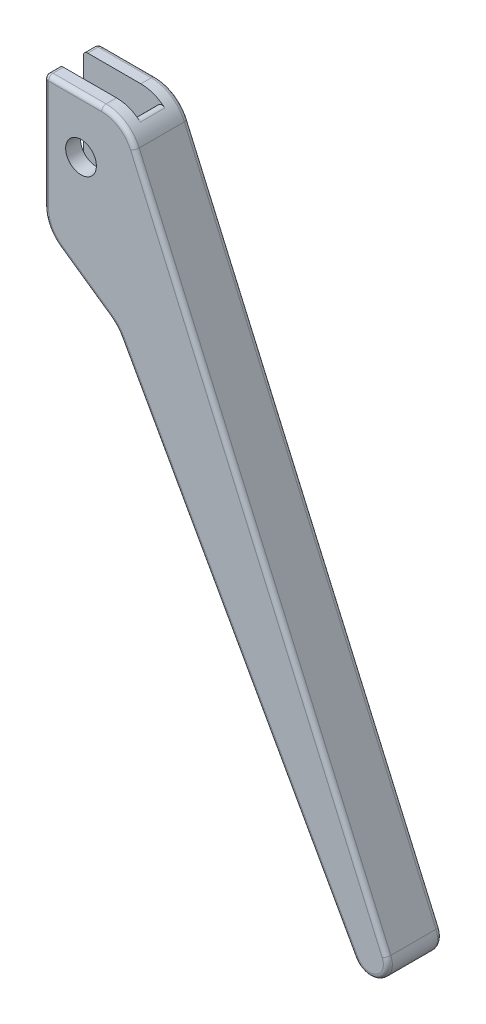
from build123d import *

# Parameters (mm, degrees)
BOSS_EXTRUDE1_DEPTH      = 3
BOSS_EXTRUDE1_DEPTH_BACK = 3
SKETCH1_R                = 1.7
CUT_EXTRUDE1_DEPTH       = 1.35
CUT_EXTRUDE1_DEPTH_BACK  = 1.35
CUT_EXTRUDE1_START       = -3
FILLET1_R                = 2
FILLET2_R                = 0.5
FILLET3_R                = 4
FILLET4_R                = 4
FILLET5_R                = 4
FILLET6_R                = 0.5
FILLET7_R                = 0.5


with BuildPart() as part:
    # Sketch1 → Boss-Extrude1 (new, two sides: drawn at the far end of the back side and taken through both)
    with BuildSketch(Plane.XY.offset(-BOSS_EXTRUDE1_DEPTH_BACK)):
        with BuildLine():
            Line((0, 0), (0, 14.741701813))
            Line((0, 14.741701813), (9, 14.741701813))
            Line((9, 14.741701813), (37.931461615, -51.19641531))
            ThreePointArc((37.931461615, -51.19641531), (36.98891746, -53.791598658), (34.3522375, -52.972278891))
            Line((34.3522375, -52.972278891), (8, -5.601660306))
            Line((8, -5.601660306), (0, 0))
        make_face()
        with Locations((4.1, 8.741701813)):
            Circle(SKETCH1_R, mode=Mode.SUBTRACT)
    extrude(amount=BOSS_EXTRUDE1_DEPTH + BOSS_EXTRUDE1_DEPTH_BACK)

    # Sketch2 → Cut-Extrude1 (cut, two sides: drawn at the far end of the back side and taken through both)
    with BuildSketch(Plane.XY.offset(3).offset(CUT_EXTRUDE1_START - CUT_EXTRUDE1_DEPTH_BACK)):
        Polygon((0, 0), (0, 14.741701813), (8.2, 14.741701813), (8.2, 5.741701813), align=None)
    extrude(amount=CUT_EXTRUDE1_DEPTH + CUT_EXTRUDE1_DEPTH_BACK, mode=Mode.SUBTRACT)

    # Fillet1
    fillet1_edges = [part.edges().sort_by_distance(p)[0] for p in [
        (8.2, 5.741701813, 0),
    ]]
    fillet(fillet1_edges, radius=FILLET1_R)

    # Fillet2
    fillet2_edges = [part.edges().sort_by_distance(p)[0] for p in [
        (0, 0, 0),
    ]]
    fillet(fillet2_edges, radius=FILLET2_R)

    # Fillet3
    fillet3_edges = [part.edges().sort_by_distance(p)[0] for p in [
        (8, -5.601660306, 0),
    ]]
    fillet(fillet3_edges, radius=FILLET3_R)

    # Fillet4
    # the kernel refuses this fillet: 4 mm, written as the material it takes off along each edge
    with BuildSketch(Plane(origin=(9, 14.741701813, 9.532571038), x_dir=(0.4017923449729062, -0.9157308073452443, 0), z_dir=(0, 0, -1))) as fillet4_piece_1:
        with BuildLine():
            CenterArc((FILLET4_R * 0.653257103757, FILLET4_R), FILLET4_R, 203.690274531, 66.309725469)
            Line((-FILLET4_R * 0.262473703589, FILLET4_R * 0.598207655027), (0, 0))
            Line((0, 0), (FILLET4_R * 0.653257103757, 0))
        make_face()
    extrude(amount=19.065142075, mode=Mode.SUBTRACT)

    # Fillet5
    fillet5_edges = [part.edges().sort_by_distance(p)[0] for p in [
        (0, 0, 2.175),
    ]]
    fillet(fillet5_edges, radius=FILLET5_R)

    # Fillet6
    fillet6_edges = [part.edges().sort_by_distance(p)[0] for p in [
        (0, 14.741701813, -2.175),
        (0, 14.741701813, 2.175),
        (8.2, 14.307221126, 0),
    ]]
    fillet(fillet6_edges, radius=FILLET6_R)

    # Fillet7
    fillet7_edges = [part.edges().sort_by_distance(p)[0] for p in [
        (4.475927023, -3.134077842, 3),
        (0.451956667, 0.235273749, 3),
        (4.475927023, -3.134077842, -3),
        (0.451956667, 0.235273749, -3),
        (0, 8.161985008, -3),
        (0.146446609, 14.595255204, -3),
        (0, 8.161985008, 3),
        (0.146446609, 14.595255204, 3),
        (36.98891746, -53.791598658, -3),
        (23.990678215, -19.423772058, -3),
        (36.98891746, -53.791598658, 3),
        (23.990678215, -19.423772058, 3),
        (21.399808273, -29.689072498, 3),
        (21.399808273, -29.689072498, -3),
        (7.922396855, -5.671641436, 3),
        (7.922396855, -5.671641436, -3),
        (3.443485792, 14.741701813, 3),
        (8.574587008, 14.090483496, 3),
        (3.443485792, 14.741701813, -3),
        (8.574587008, 14.090483496, -3),
    ]]
    fillet(fillet7_edges, radius=FILLET7_R)


solid = part.part
